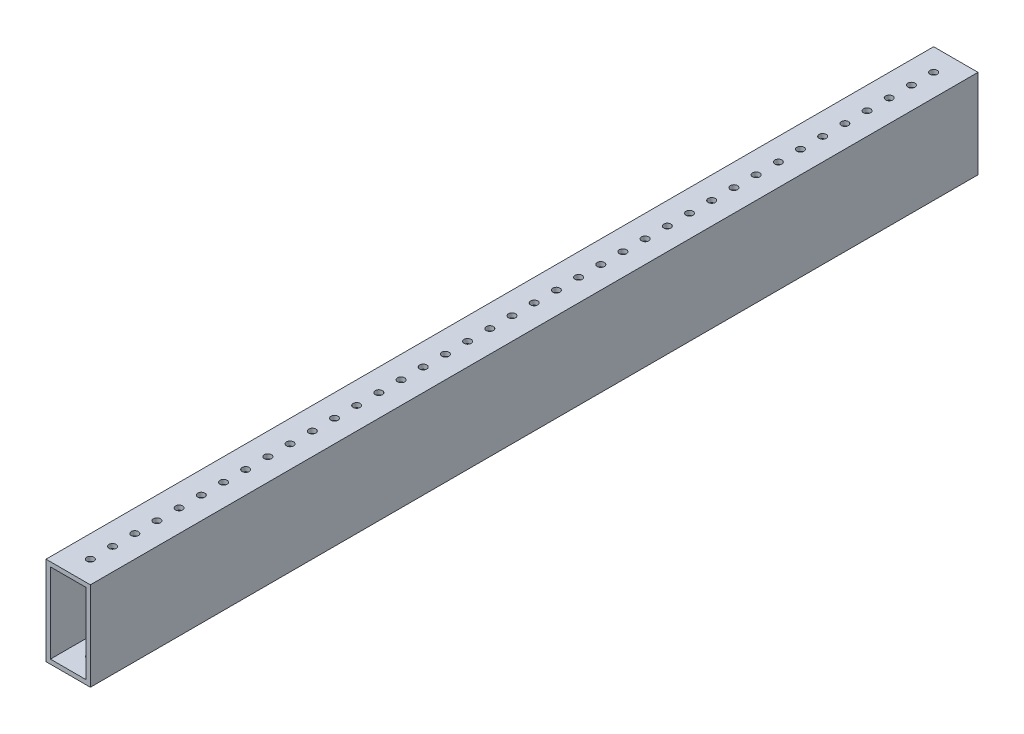
from build123d import *

# Parameters (mm, degrees)
SKETCH1_W           = 25.4
SKETCH1_H           = 50.8
SKETCH1_W_2         = 20.32
SKETCH1_H_2         = 45.72
BOSS_EXTRUDE1_DEPTH = 508
SKETCH2_R           = 2.032
CUT_EXTRUDE1_DEPTH  = 508


with BuildPart() as part:
    # Sketch1 → Boss-Extrude1 (new body)
    with BuildSketch(Plane.XY):
        with Locations((12.7, 25.4)):
            Rectangle(SKETCH1_W, SKETCH1_H)
        with Locations((12.7, 25.4)):
            Rectangle(SKETCH1_W_2, SKETCH1_H_2, mode=Mode.SUBTRACT)
    extrude(amount=BOSS_EXTRUDE1_DEPTH)

    # Sketch2 → Cut-Extrude1 (cut)
    with BuildSketch(Plane(origin=(0, 50.8, 0), x_dir=(1, 0, 0), z_dir=(0, 1, 0))):
        with Locations((12.7, -12.7)):
            Circle(SKETCH2_R)
        with Locations((12.7, -25.4)):
            Circle(SKETCH2_R)
        with Locations((12.7, -38.1)):
            Circle(SKETCH2_R)
        with Locations((12.7, -50.8)):
            Circle(SKETCH2_R)
        with Locations((12.7, -63.5)):
            Circle(SKETCH2_R)
        with Locations((12.7, -76.2)):
            Circle(SKETCH2_R)
        with Locations((12.7, -88.9)):
            Circle(SKETCH2_R)
        with Locations((12.7, -101.6)):
            Circle(SKETCH2_R)
        with Locations((12.7, -114.3)):
            Circle(SKETCH2_R)
        with Locations((12.7, -127)):
            Circle(SKETCH2_R)
        with Locations((12.7, -139.7)):
            Circle(SKETCH2_R)
        with Locations((12.7, -152.4)):
            Circle(SKETCH2_R)
        with Locations((12.7, -165.1)):
            Circle(SKETCH2_R)
        with Locations((12.7, -177.8)):
            Circle(SKETCH2_R)
        with Locations((12.7, -190.5)):
            Circle(SKETCH2_R)
        with Locations((12.7, -203.2)):
            Circle(SKETCH2_R)
        with Locations((12.7, -215.9)):
            Circle(SKETCH2_R)
        with Locations((12.7, -228.6)):
            Circle(SKETCH2_R)
        with Locations((12.7, -241.3)):
            Circle(SKETCH2_R)
        with Locations((12.7, -254)):
            Circle(SKETCH2_R)
        with Locations((12.7, -266.7)):
            Circle(SKETCH2_R)
        with Locations((12.7, -279.4)):
            Circle(SKETCH2_R)
        with Locations((12.7, -292.1)):
            Circle(SKETCH2_R)
        with Locations((12.7, -304.8)):
            Circle(SKETCH2_R)
        with Locations((12.7, -317.5)):
            Circle(SKETCH2_R)
        with Locations((12.7, -330.2)):
            Circle(SKETCH2_R)
        with Locations((12.7, -342.9)):
            Circle(SKETCH2_R)
        with Locations((12.7, -355.6)):
            Circle(SKETCH2_R)
        with Locations((12.7, -368.3)):
            Circle(SKETCH2_R)
        with Locations((12.7, -381)):
            Circle(SKETCH2_R)
        with Locations((12.7, -393.7)):
            Circle(SKETCH2_R)
        with Locations((12.7, -406.4)):
            Circle(SKETCH2_R)
        with Locations((12.7, -419.1)):
            Circle(SKETCH2_R)
        with Locations((12.7, -431.8)):
            Circle(SKETCH2_R)
        with Locations((12.7, -444.5)):
            Circle(SKETCH2_R)
        with Locations((12.7, -457.2)):
            Circle(SKETCH2_R)
        with Locations((12.7, -469.9)):
            Circle(SKETCH2_R)
        with Locations((12.7, -482.6)):
            Circle(SKETCH2_R)
        with Locations((12.7, -495.3)):
            Circle(SKETCH2_R)
    extrude(amount=-CUT_EXTRUDE1_DEPTH, mode=Mode.SUBTRACT)


solid = part.part
